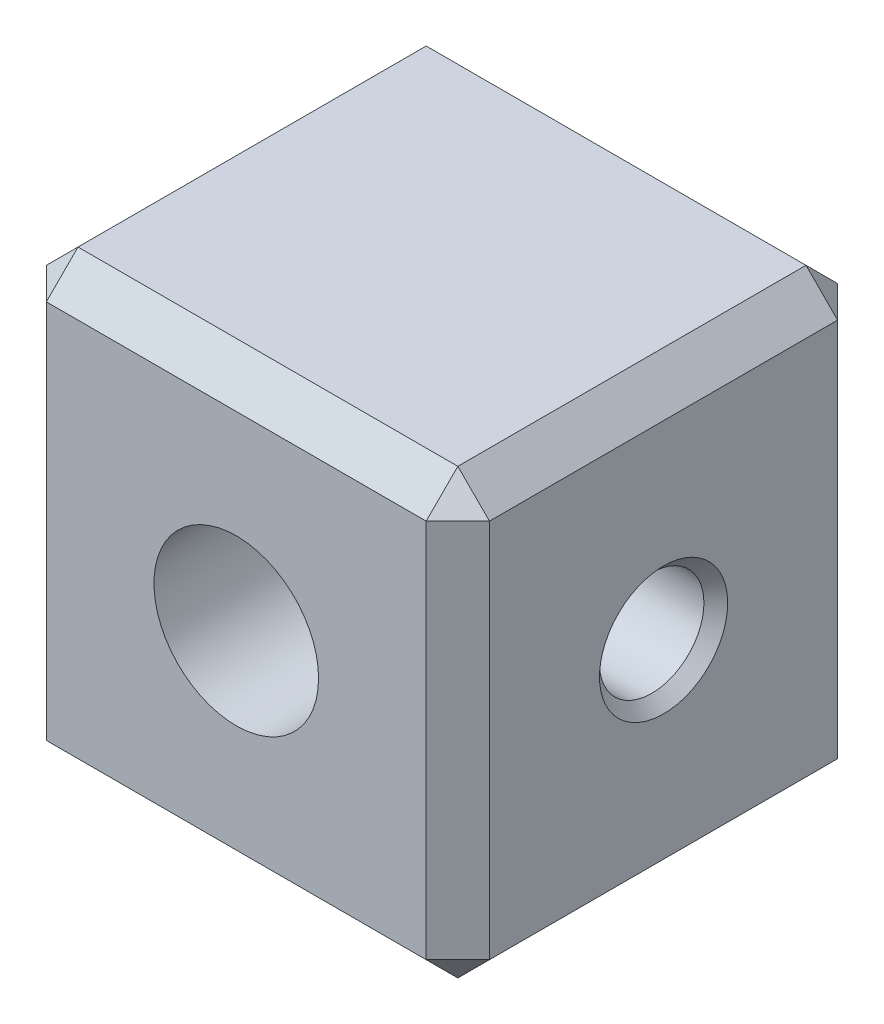
from build123d import *

# Parameters (mm, degrees)
SKETCH1_W           = 14
SKETCH1_H           = 14
SKETCH1_R           = 2.6
BOSS_EXTRUDE1_DEPTH = 13
CHAMFER1_SIZE       = 1


# Read off the part's stored shape, not the designer's step: M4 Tapped Hole1
with BuildPart() as part:
    # Sketch1 → Boss-Extrude1 (new body)
    with BuildSketch(Plane.XY):
        Rectangle(SKETCH1_W, SKETCH1_H)
        with Locations(Location((0, 0, 0), (0, 0, 180))):
            Circle(SKETCH1_R, mode=Mode.SUBTRACT)
    extrude(amount=BOSS_EXTRUDE1_DEPTH)

    # Chamfer1
    chamfer1_edges = [part.edges().sort_by_distance(p)[0] for p in [
        (7, 0, 13),
        (0, 7, 13),
        (-7, 0, 13),
        (0, 7, 0),
        (7, 0, 0),
        (0, -7, 0),
        (-7, 0, 0),
        (0, -7, 13),
        (-7, 7, 6.5),
        (7, 7, 6.5),
        (7, -7, 6.5),
        (-7, -7, 6.5),
    ]]
    chamfer(chamfer1_edges, length=CHAMFER1_SIZE)

    # M4 Tapped Hole1 outline → M4 Tapped Hole1 (revolve, cut)
    with BuildSketch(Plane.YX.offset(-6.5)):
        Polygon((0, 2.009055278), (1.65, 2.009055278), (1.65, 6.625), (2.025, 7), (0, 7), align=None)
    revolve(axis=Axis((0, 0, 6.5), (1, 0, 0)), mode=Mode.SUBTRACT)


solid = part.part
